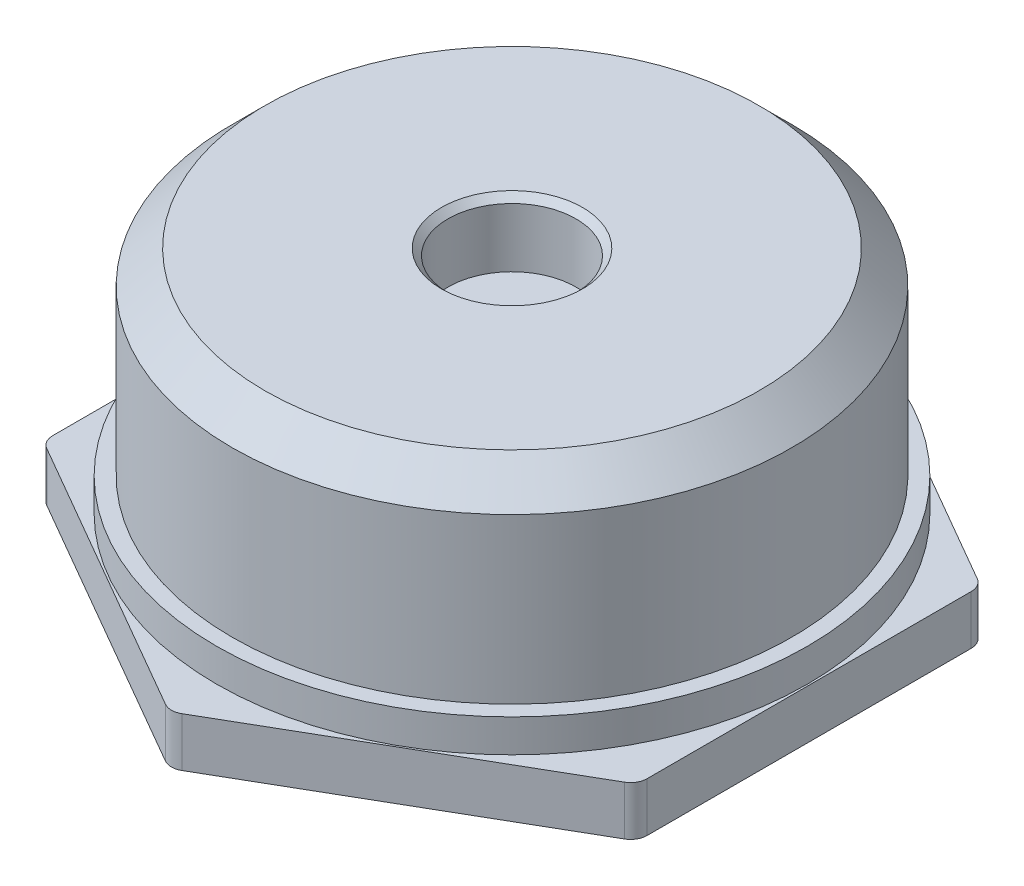
from build123d import *

# Parameters (mm, degrees)
BOSS_EXTRUDE1_DEPTH      = 1.5
FILLET1_R                = 0.5
SKETCH2_R                = 9
BOSS_EXTRUDE2_DEPTH      = 1
SKETCH3_R                = 8.525
BOSS_EXTRUDE3_DEPTH      = 4
CUT_EXTRUDE1_DEPTH       = 16.223179353
BOSS_EXTRUDE4_DEPTH      = 1
BOSS_EXTRUDE4_DEPTH_BACK = 1
SKETCH5_R                = 8.525
SKETCH6_R                = 8.525
BOSS_EXTRUDE5_DEPTH      = 1
CHAMFER2_SIZE            = 1
SKETCH7_R                = 1.95
CUT_EXTRUDE2_DEPTH       = 2
CHAMFER3_SIZE            = 0.2


with BuildPart() as part:
    # Sketch1 → Boss-Extrude1 (new body)
    with BuildSketch(Plane(origin=(0, 31, 0), x_dir=(1, 0, 0), z_dir=(0, 1, 0))):
        Polygon((0, 10.450039872), (-9.05, 5.225019936), (-9.05, -5.225019936), (0, -10.450039872), (9.05, -5.225019936), (9.05, 5.225019936), align=None)
    extrude(amount=BOSS_EXTRUDE1_DEPTH)

    # Fillet1
    fillet1_edges = [part.edges().sort_by_distance(p)[0] for p in [
        (0, 31.75, -10.450039872),
        (-9.05, 31.75, -5.225019936),
        (-9.05, 31.75, 5.225019936),
        (0, 31.75, 10.450039872),
        (9.05, 31.75, 5.225019936),
        (9.05, 31.75, -5.225019936),
    ]]
    fillet(fillet1_edges, radius=FILLET1_R)

    # Sketch2 → Boss-Extrude2 (add)
    with BuildSketch(Plane(origin=(0, 32.5, 0), x_dir=(1, 0, 0), z_dir=(0, 1, 0))):
        Circle(SKETCH2_R)
    extrude(amount=BOSS_EXTRUDE2_DEPTH)

    # Sketch3 → Boss-Extrude3 (add)
    with BuildSketch(Plane(origin=(0, 33.5, 0), x_dir=(1, 0, 0), z_dir=(0, 1, 0))):
        Circle(SKETCH3_R)
    extrude(amount=BOSS_EXTRUDE3_DEPTH)

    # Sketch4 → Cut-Extrude1 (cut, through all)
    with BuildSketch(Plane(origin=(0, 37.5, 0), x_dir=(1, 0, 0), z_dir=(0, 1, 0))):
        Polygon((0, 2.886751346), (-2.5, 1.443375673), (-2.5, -1.443375673), (0, -2.886751346), (2.5, -1.443375673), (2.5, 1.443375673), align=None)
    extrude(amount=-CUT_EXTRUDE1_DEPTH, mode=Mode.SUBTRACT)

    # Sketch5 → Boss-Extrude4 (add, two sides: drawn at the far end of the back side and taken through both)
    with BuildSketch(Plane(origin=(0, 37.5, 0), x_dir=(1, 0, 0), z_dir=(0, 1, 0)).offset(-BOSS_EXTRUDE4_DEPTH_BACK)):
        Circle(SKETCH5_R)
    extrude(amount=BOSS_EXTRUDE4_DEPTH + BOSS_EXTRUDE4_DEPTH_BACK)

    # Sketch6 → Boss-Extrude5 (add)
    with BuildSketch(Plane(origin=(0, 38.5, 0), x_dir=(1, 0, 0), z_dir=(0, 1, 0))):
        Circle(SKETCH6_R)
    extrude(amount=BOSS_EXTRUDE5_DEPTH)

    # Chamfer2
    chamfer2_edges = [part.edges().sort_by_distance(p)[0] for p in [
        (-8.525, 39.5, 0),
    ]]
    chamfer(chamfer2_edges, length=CHAMFER2_SIZE)

    # Sketch7 → Cut-Extrude2 (cut)
    with BuildSketch(Plane(origin=(0, 39.5, 0), x_dir=(1, 0, 0), z_dir=(0, 1, 0))):
        Circle(SKETCH7_R)
    extrude(amount=-CUT_EXTRUDE2_DEPTH, mode=Mode.SUBTRACT)

    # Chamfer3
    chamfer3_edges = [part.edges().sort_by_distance(p)[0] for p in [
        (-1.95, 39.5, 0),
    ]]
    chamfer(chamfer3_edges, length=CHAMFER3_SIZE)


solid = part.part
